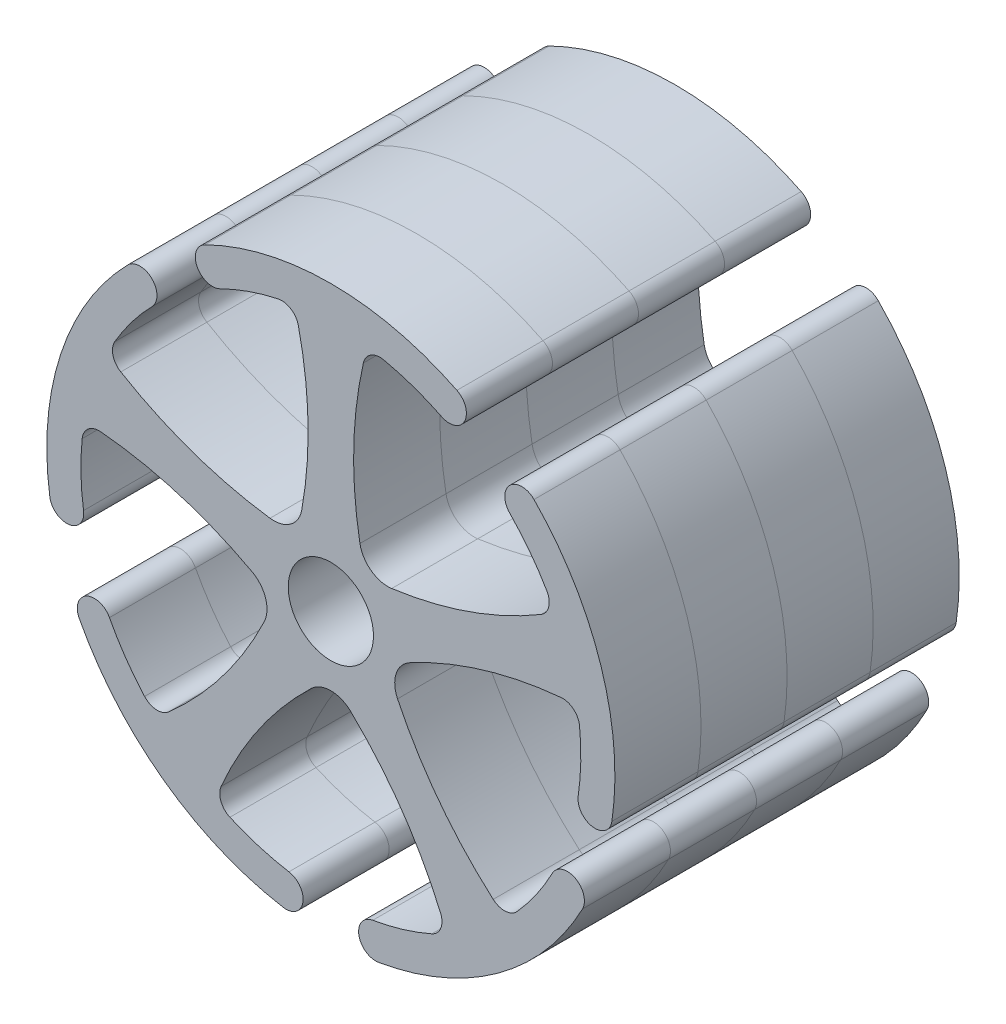
from build123d import *
from OCP.BRepFilletAPI import BRepFilletAPI_MakeFillet

# Parameters (mm, degrees)
BOSS_EXTRUDE3_DEPTH = 3.03
CIRPATTERN1_COUNT   = 5
SKETCH6_R           = 1.5
CUT_EXTRUDE1_DEPTH  = 82
FILLET1_R1          = 1
FILLET1_R2          = 0.6
LPATTERN1_COUNT     = 4
LPATTERN1_PITCH     = 3.03


with BuildPart() as part:
    # Sketch2 → Boss-Extrude3 (new body)
    with BuildSketch(Plane.XY):
        with BuildLine():
            Line((-1.754642488, 0), (1.754642488, 0))
            ThreePointArc((1.754642488, 0), (0.820600043, 4.315154407), (1.283219684, 8.705937471))
            ThreePointArc((1.283219684, 8.705937471), (2.626309951, 8.398958033), (3.905026871, 7.886112168))
            ThreePointArc((3.905026871, 7.886112168), (4.70896817, 8.157549802), (4.437530536, 8.961491101))
            ThreePointArc((4.437530536, 8.961491101), (0, 10), (-4.437530536, 8.961491101))
            ThreePointArc((-4.437530536, 8.961491101), (-4.70896817, 8.157549802), (-3.905026871, 7.886112168))
            ThreePointArc((-3.905026871, 7.886112168), (-2.626309951, 8.398958033), (-1.283219684, 8.705937471))
            ThreePointArc((-1.283219684, 8.705937471), (-0.820600043, 4.315154407), (-1.754642488, 0))
        make_face()
    extrude(amount=-BOSS_EXTRUDE3_DEPTH)

    # CirPattern1: part ×5 about axis
    cirpattern1_axis = Axis((0, 0, 0), (0, 0, -1))


with BuildPart() as part_1:
    add(part.part)
    for i in range(1, CIRPATTERN1_COUNT):
        add(part.part.rotate(cirpattern1_axis, i * 360 / CIRPATTERN1_COUNT))

    # Sketch6 → Cut-Extrude1 (cut)
    with BuildSketch(Plane(origin=(0, 0, -3.03), x_dir=(-1, 0, 0), z_dir=(0, 0, -1))):
        Circle(SKETCH6_R)
    extrude(amount=-CUT_EXTRUDE1_DEPTH, mode=Mode.SUBTRACT)

    # Fillet1: one fillet with a radius per group of edges: ONE call of the kernel's fillet builder (fillet() takes one radius for all edges)
    fillet1_edges_1 = [part_1.edges().sort_by_distance(p)[0] for p in [
        (-1.219020394, 1.67783763, -1.515),
        (-1.97241643, -0.640876947, -1.515),
        (0, -2.073921366, -1.515),
        (1.97241643, -0.640876947, -1.515),
        (1.219020394, 1.67783763, -1.515),
    ]]
    fillet1_edges_2 = [part_1.edges().sort_by_distance(p)[0] for p in [
        (-1.283219684, 8.705937471, -1.515),
        (1.283219684, 8.705937471, -1.515),
        (-7.883301872, 3.910697072, -1.515),
        (-8.676375252, 1.469868188, -1.515),
        (-6.155368184, -6.28899376, -1.515),
        (6.155368184, -6.28899376, -1.515),
        (-4.079075121, -7.797508971, -1.515),
        (4.079075121, -7.797508971, -1.515),
        (8.676375252, 1.469868188, -1.515),
        (7.883301872, 3.910697072, -1.515),
    ]]
    fillet1 = BRepFilletAPI_MakeFillet(part_1.part.solid().wrapped)
    for e in fillet1_edges_1:
        fillet1.Add(FILLET1_R1, e.wrapped)
    for e in fillet1_edges_2:
        fillet1.Add(FILLET1_R2, e.wrapped)
    add(Compound.cast(fillet1.Shape()), mode=Mode.REPLACE)


with BuildPart() as lpattern1_1:
    # LPattern1: pattern copy
    add(part_1.part.moved(Location(Vector(0, 0, 1) * (1 * LPATTERN1_PITCH))))


with BuildPart() as lpattern1_2:
    # LPattern1: pattern copy
    add(part_1.part.moved(Location(Vector(0, 0, 1) * (2 * LPATTERN1_PITCH))))


with BuildPart() as lpattern1_3:
    # LPattern1: pattern copy
    add(part_1.part.moved(Location(Vector(0, 0, 1) * (3 * LPATTERN1_PITCH))))


solid = Compound([part_1.part, lpattern1_1.part, lpattern1_2.part, lpattern1_3.part])
